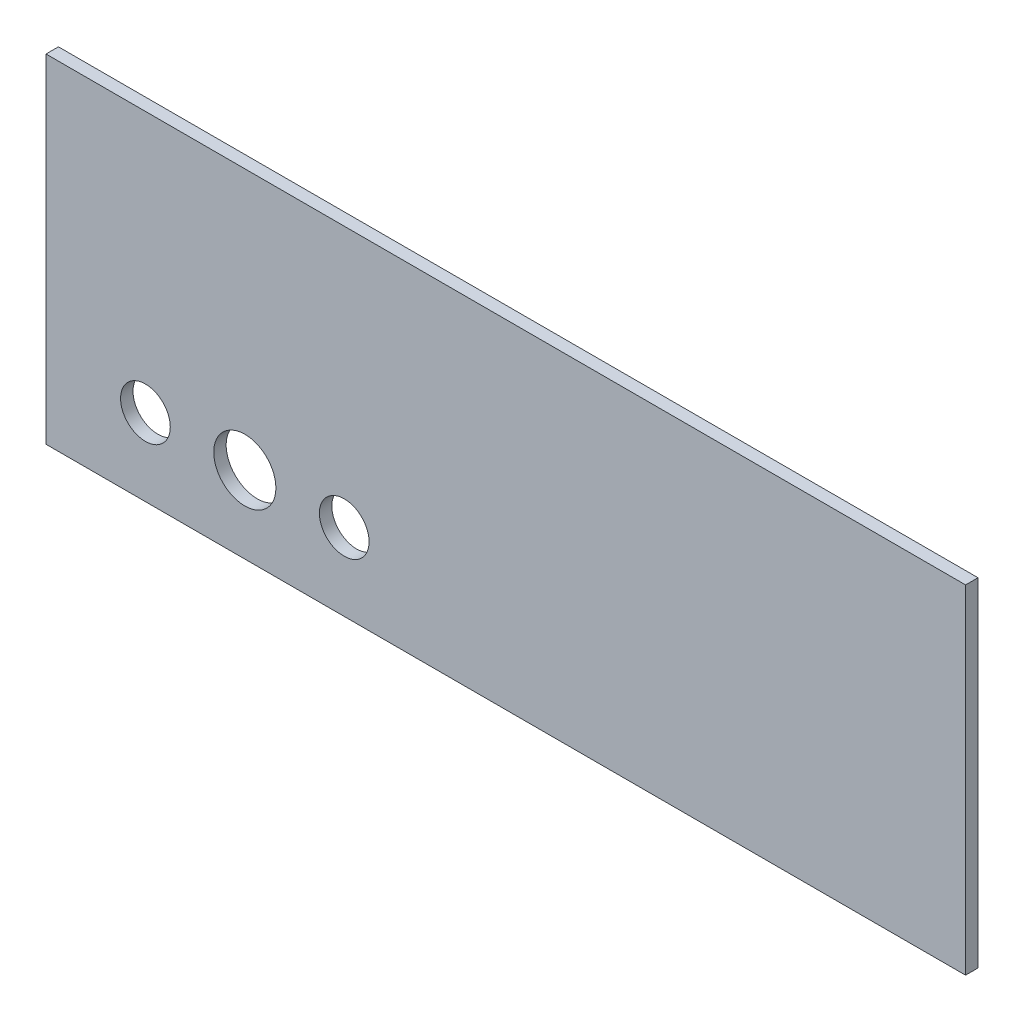
from build123d import *

# Parameters (mm, degrees)
SKETCH1_W          = 234.95
SKETCH1_H          = 86.36
BASE_FLANGE1_DEPTH = 3.175
SKETCH11_R         = 7.9375
CUT_EXTRUDE3_DEPTH = 126.199715056
SKETCH13_R         = 6.35
CUT_EXTRUDE5_DEPTH = 126.199715056
SKETCH14_R         = 6.35
CUT_EXTRUDE6_DEPTH = 126.199715056


# Sheet-metal steps are written as plain solids
with BuildPart() as part:
    # Sketch1 → Base-Flange1 (new body)
    with BuildSketch(Plane.XY):
        Rectangle(SKETCH1_W, SKETCH1_H)
    extrude(amount=-BASE_FLANGE1_DEPTH)

    # Sketch11 → Cut-Extrude3 (cut, through all)
    with BuildSketch(Plane.XY):
        with Locations((-66.675, -23.495)):
            Circle(SKETCH11_R)
    extrude(amount=-CUT_EXTRUDE3_DEPTH, mode=Mode.SUBTRACT)

    # Sketch13 → Cut-Extrude5 (cut, through all)
    with BuildSketch(Plane.XY):
        with Locations((-41.275, -23.495)):
            Circle(SKETCH13_R)
    extrude(amount=-CUT_EXTRUDE5_DEPTH, mode=Mode.SUBTRACT)

    # Sketch14 → Cut-Extrude6 (cut, through all)
    with BuildSketch(Plane.XY):
        with Locations((-92.075, -23.495)):
            Circle(SKETCH14_R)
    extrude(amount=-CUT_EXTRUDE6_DEPTH, mode=Mode.SUBTRACT)


solid = part.part
